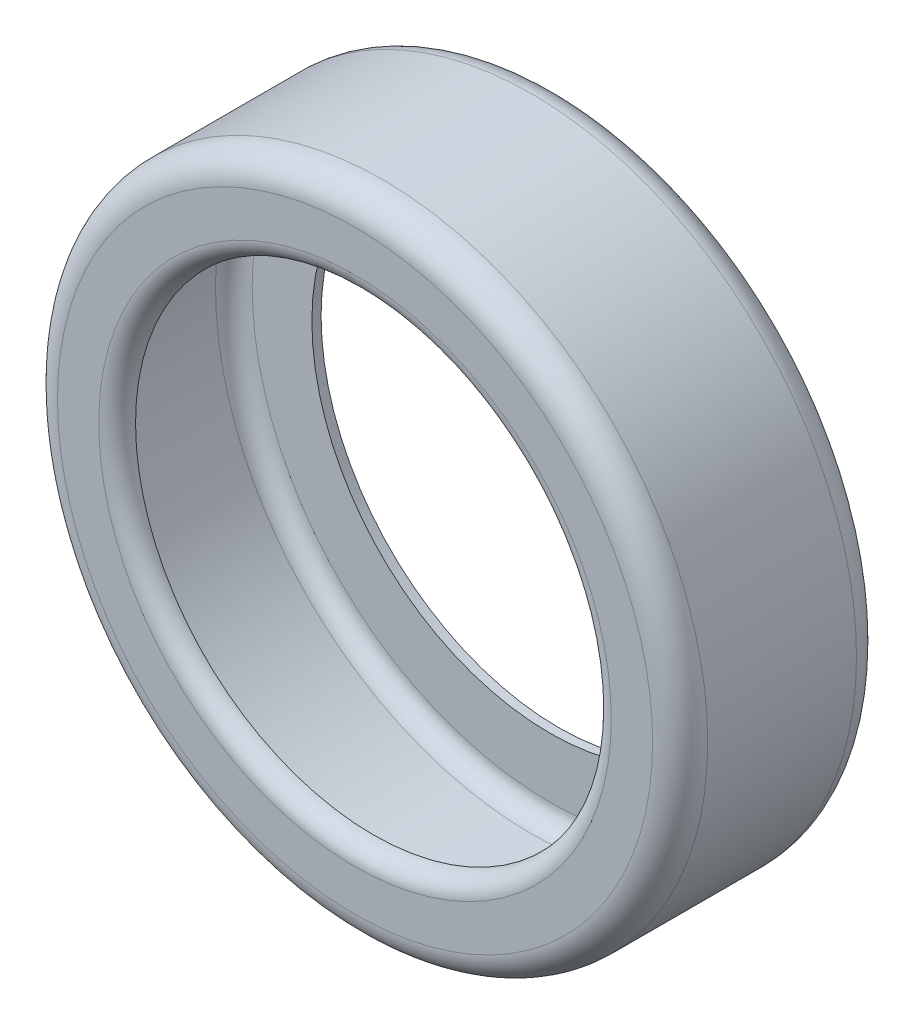
from build123d import *

# Parameters (mm, degrees)
SKETCH1_R           = 354
SKETCH1_R_2         = 259
BOSS_EXTRUDE1_DEPTH = 222
FILLET1_R           = 30
FILLET2_R           = 20


# Read off the part's stored shape, not the designer's step: Shell2
with BuildPart() as part:
    # Sketch1 → Boss-Extrude1 (new body)
    with BuildSketch(Plane.XY):
        Circle(SKETCH1_R)
        Circle(SKETCH1_R_2, mode=Mode.SUBTRACT)
    extrude(amount=BOSS_EXTRUDE1_DEPTH)

    # Fillet1
    fillet1_edges = [part.edges().sort_by_distance(p)[0] for p in [
        (-354, 0, 0),
        (-354, 0, 222),
    ]]
    fillet(fillet1_edges, radius=FILLET1_R)

    # Fillet2
    fillet2_edges = [part.edges().sort_by_distance(p)[0] for p in [
        (-259, 0, 222),
    ]]
    fillet(fillet2_edges, radius=FILLET2_R)

    # Shell2 outline → Shell2 (revolve, cut)
    with BuildSketch(Plane.XZ):
        with BuildLine():
            Line((269, 202), (259, 202))
            Line((259, 202), (259, 10))
            Line((259, 10), (324, 10))
            ThreePointArc((324, 10), (338.142135624, 15.857864376), (344, 30))
            Line((344, 30), (344, 192))
            ThreePointArc((344, 192), (338.142135624, 206.142135624), (324, 212))
            Line((324, 212), (279, 212))
            ThreePointArc((279, 212), (271.928932188, 209.071067812), (269, 202))
        make_face()
    revolve(axis=Axis((0, 0, 0), (0, 0, 1)), mode=Mode.SUBTRACT)


solid = part.part
